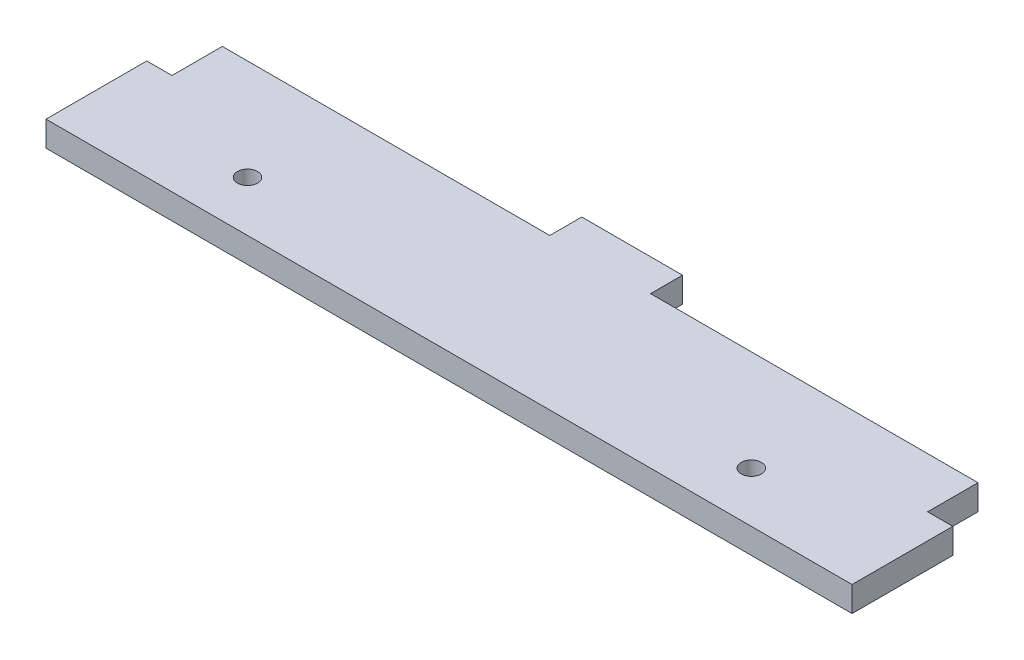
from build123d import *

# Parameters (mm, degrees)
SKETCH1_R           = 2
BOSS_EXTRUDE1_DEPTH = 2.5


with BuildPart() as part:
    # Sketch1 → Boss-Extrude1 (new, symmetric)
    with BuildSketch(Plane(origin=(0, 0, 0), x_dir=(1, 0, 0), z_dir=(0, 1, 0))):
        Polygon((-80, -18.175), (80, -18.175), (80, 1.825), (75, 1.825), (75, 11.825), (10, 11.825), (10, 18.175), (-10, 18.175), (-10, 11.825), (-75, 11.825), (-75, 1.825), (-80, 1.825), align=None)
        with Locations((-50, -8.175)):
            Circle(SKETCH1_R, mode=Mode.SUBTRACT)
        with Locations((50, -8.175)):
            Circle(SKETCH1_R, mode=Mode.SUBTRACT)
    extrude(amount=BOSS_EXTRUDE1_DEPTH, both=True)


solid = part.part
